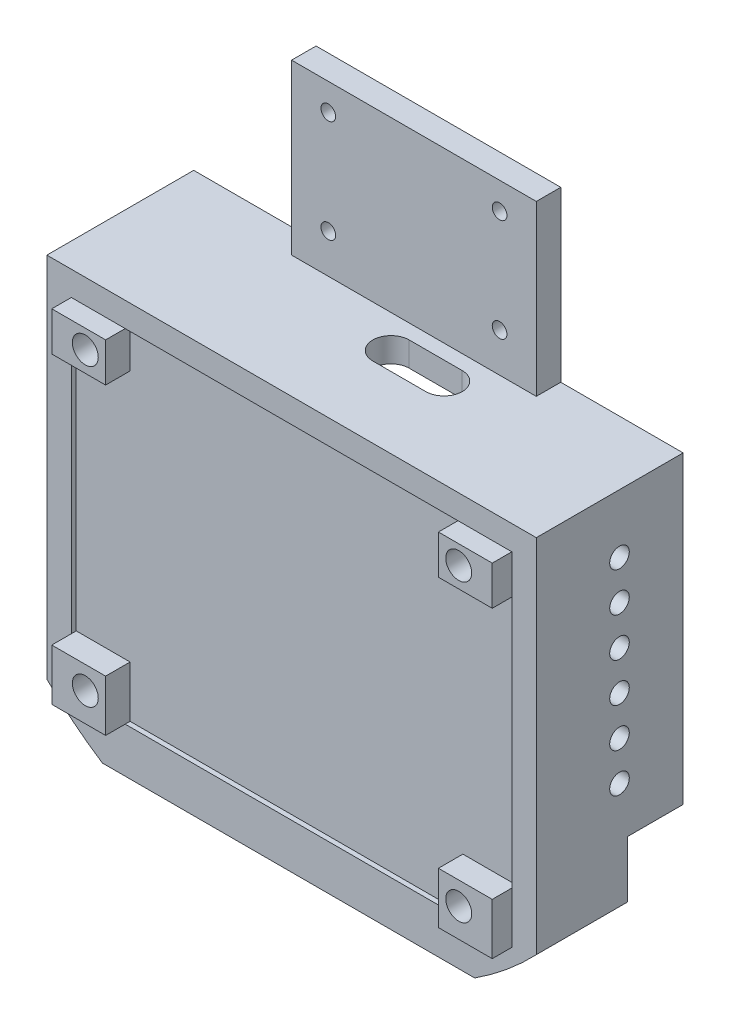
from build123d import *

# Parameters (mm, degrees)
RESSALTO_EXTRUS_O1_DEPTH   = 30
ESBO_O10_W                 = 112.198297798
ESBO_O10_H                 = 48.296192569
CORTE_EXTRUS_O6_DEPTH      = 25
CORTE_EXTRUS_O7_DEPTH      = 90.92898472
CORTE_EXTRUS_O7_DEPTH_BACK = 90.92898472
ESBO_O12_W                 = 36.72404194
ESBO_O12_H                 = 46.699624219
ESBO_O12_W_2               = 36.523308256
ESBO_O12_W_3               = 76.065965206
ESBO_O12_H_2               = 16.622456002
ESBO_O13_W                 = 35
ESBO_O13_H                 = 55
CORTE_EXTRUS_O8_DEPTH      = 20
CORTE_EXTRUS_O9_DEPTH      = 20
ESBO_O15_W                 = 90
ESBO_O15_H                 = 70
CORTE_EXTRUS_O10_DEPTH     = 1
ESBO_O16_W                 = 22.5
ESBO_O16_H                 = 55
CORTE_EXTRUS_O11_DEPTH     = 25
ESBO_O18_W                 = 90
ESBO_O18_H                 = 55
RESSALTO_EXTRUS_O2_DEPTH   = 3
ESBO_O19_W                 = 35
ESBO_O19_H                 = 55
CORTE_EXTRUS_O12_DEPTH     = 3
ESBO_O20_R                 = 2
CORTE_EXTRUS_O13_DEPTH     = 1500
ESBO_O21_W                 = 105.588179738
ESBO_O21_H                 = 28.353928622
CORTE_EXTRUS_O14_DEPTH     = 11.4
CORTE_EXTRUS_O15_DEPTH     = 10
ESBO_O23_R                 = 1.5
CORTE_EXTRUS_O16_DEPTH     = 6
ESBO_O29_W                 = 7
ESBO_O29_H                 = 30
CORTE_EXTRUS_O18_DEPTH     = 1.2
ESBO_O31_W                 = 2.3
ESBO_O31_H                 = 4
CORTE_EXTRUS_O19_DEPTH     = 4
ESBO_O33_W                 = 1
ESBO_O33_H                 = 6
CORTE_EXTRUS_O20_DEPTH     = 4
ESBO_O34_R                 = 2.5
CORTE_EXTRUS_O21_DEPTH     = 6
ESBO_O35_W                 = 11
ESBO_O35_H                 = 8
ESBO_O35_H_2               = 10.5
RESSALTO_EXTRUS_O3_DEPTH   = 5
ESBO_O36_R                 = 2.65
CORTE_EXTRUS_O22_DEPTH     = 4.7
ESBO_O38_W                 = 36
ESBO_O38_H                 = 57
CORTE_EXTRUS_O23_DEPTH     = 1.2
FILETE4_R                  = 1
FILETE5_R                  = 1
FILETE6_R                  = 1
ESBO_O40_R                 = 4.036676011
CORTE_EXTRUS_O25_DEPTH     = 1
FILETE9_R                  = 4


with BuildPart() as part:
    # Esboço1 → Ressalto-extrusão1 (new body)
    with BuildSketch(Plane.XY):
        with BuildLine():
            Line((-49.381601242, -49.613077498), (-49.381601242, 49.613077498))
            ThreePointArc((-49.381601242, 49.613077498), (0.883684189, 69.994421937), (50.618398758, 48.350570908))
            Line((50.618398758, 48.350570908), (50.618398758, -48.350570908))
            ThreePointArc((50.618398758, -48.350570908), (0.883684189, -69.994421937), (-49.381601242, -49.613077498))
        make_face()
    extrude(amount=RESSALTO_EXTRUS_O1_DEPTH)

    # Esboço10 → Corte-extrusão6 (cut)
    with BuildSketch(Plane.XY.offset(30)):
        with Locations((0, 49.593404353)):
            Rectangle(ESBO_O10_W, ESBO_O10_H)
    extrude(amount=-CORTE_EXTRUS_O6_DEPTH, mode=Mode.SUBTRACT)

    # Esboço12 → Corte-extrusão7 (cut, two sides: drawn at the far end of the back side and taken through both)
    with BuildSketch(Plane.XY.offset(5).offset(-CORTE_EXTRUS_O7_DEPTH_BACK)):
        with Locations((-42.743622212, 48.795120178)):
            Rectangle(ESBO_O12_W, ESBO_O12_H)
        with Locations((43.880052886, 48.795120178)):
            Rectangle(ESBO_O12_W_2, ESBO_O12_H)
        with Locations((0, -67.077648977)):
            Rectangle(ESBO_O12_W_3, ESBO_O12_H_2)
    extrude(amount=CORTE_EXTRUS_O7_DEPTH + CORTE_EXTRUS_O7_DEPTH_BACK, mode=Mode.SUBTRACT)

    # Esboço13 → Corte-extrusão8 (cut)
    with BuildSketch(Plane(origin=(0, 0, 0), x_dir=(-1, 0, 0), z_dir=(0, 0, -1))):
        with Locations((-0.618398758, -7.054691932)):
            Rectangle(ESBO_O13_W, ESBO_O13_H)
    extrude(amount=-CORTE_EXTRUS_O8_DEPTH, mode=Mode.SUBTRACT)

    # Esboço14 → Corte-extrusão9 (cut)
    with BuildSketch(Plane(origin=(0, 25.445308068, 0), x_dir=(1, 0, 0), z_dir=(0, 1, 0))):
        with BuildLine():
            Line((2.653109582, -7.998476533), (13.483040952, -7.998476533))
            ThreePointArc((13.483040952, -7.998476533), (17.204697231, -11.720132813), (13.483040952, -15.441789092))
            Line((13.483040952, -15.441789092), (2.653109582, -15.441789092))
            ThreePointArc((2.653109582, -15.441789092), (-1.068546697, -11.720132813), (2.653109582, -7.998476533))
        make_face()
    extrude(amount=-CORTE_EXTRUS_O9_DEPTH, mode=Mode.SUBTRACT)

    # Esboço15 → Corte-extrusão10 (cut)
    with BuildSketch(Plane.XY.offset(30)):
        with Locations((0.618398758, -14.554691932)):
            Rectangle(ESBO_O15_W, ESBO_O15_H)
    extrude(amount=-CORTE_EXTRUS_O10_DEPTH, mode=Mode.SUBTRACT)

    # Esboço16 → Corte-extrusão11 (cut)
    with BuildSketch(Plane(origin=(0, 0, 0), x_dir=(-1, 0, 0), z_dir=(0, 0, -1))):
        with Locations((-34.368398758, -7.054691932)):
            Rectangle(ESBO_O16_W, ESBO_O16_H)
        with Locations((33.131601242, -7.054691932)):
            Rectangle(ESBO_O16_W, ESBO_O16_H)
    extrude(amount=-CORTE_EXTRUS_O11_DEPTH, mode=Mode.SUBTRACT)

    # Esboço18 → Ressalto-extrusão2 (add)
    with BuildSketch(Plane(origin=(0, 0, 0), x_dir=(-1, 0, 0), z_dir=(0, 0, -1))):
        with Locations((-0.618398758, -7.054691932)):
            Rectangle(ESBO_O18_W, ESBO_O18_H)
    extrude(amount=-RESSALTO_EXTRUS_O2_DEPTH)

    # Esboço19 → Corte-extrusão12 (cut)
    with BuildSketch(Plane(origin=(0, 0, 0), x_dir=(-1, 0, 0), z_dir=(0, 0, -1))):
        with Locations((-0.618398758, -7.054691932)):
            Rectangle(ESBO_O19_W, ESBO_O19_H)
    extrude(amount=-CORTE_EXTRUS_O12_DEPTH, mode=Mode.SUBTRACT)

    # Esboço20 → Corte-extrusão13 (cut)
    with BuildSketch(Plane(origin=(50.618398758, 0, 0), x_dir=(0, 0, -1), z_dir=(1, 0, 0))):
        with Locations((-13, 5.445308068)):
            Circle(ESBO_O20_R)
        with Locations((-13, -2.554691932)):
            Circle(ESBO_O20_R)
        with Locations((-13, 13.445308068)):
            Circle(ESBO_O20_R)
        with Locations((-13, -10.554691932)):
            Circle(ESBO_O20_R)
        with Locations((-13, -18.554691932)):
            Circle(ESBO_O20_R)
        with Locations((-13, -26.554691932)):
            Circle(ESBO_O20_R)
    extrude(amount=-CORTE_EXTRUS_O13_DEPTH, mode=Mode.SUBTRACT)

    # Esboço21 → Corte-extrusão14 (cut)
    with BuildSketch(Plane(origin=(0, 0, 0), x_dir=(-1, 0, 0), z_dir=(0, 0, -1))):
        with Locations((2.175691111, -50.943385287)):
            Rectangle(ESBO_O21_W, ESBO_O21_H)
    extrude(amount=-CORTE_EXTRUS_O14_DEPTH, mode=Mode.SUBTRACT)

    # Esboço22 → Corte-extrusão15 (cut)
    with BuildSketch(Plane.XY.offset(5)):
        Polygon((-29.980530995, 70.945308068), (31.249974599, 70.942177058), (31.249974599, 59.945308068), (-29.980530995, 59.945308068), align=None)
    extrude(amount=-CORTE_EXTRUS_O15_DEPTH, mode=Mode.SUBTRACT)

    # Esboço23 → Corte-extrusão16 (cut)
    with BuildSketch(Plane.XY.offset(5)):
        with Locations((-16.881601242, 54.445308068)):
            Circle(ESBO_O23_R)
        with Locations((-16.881601242, 33.445308068)):
            Circle(ESBO_O23_R)
        with Locations((18.118398758, 33.445308068)):
            Circle(ESBO_O23_R)
        with Locations((18.118398758, 54.445308068)):
            Circle(ESBO_O23_R)
    extrude(amount=-CORTE_EXTRUS_O16_DEPTH, mode=Mode.SUBTRACT)

    # Esboço29 → Corte-extrusão18 (cut)
    with BuildSketch(Plane(origin=(0, 0, 0), x_dir=(-1, 0, 0), z_dir=(0, 0, -1))):
        with Locations((-21.618398758, -7.054691932)):
            Rectangle(ESBO_O29_W, ESBO_O29_H)
    extrude(amount=-CORTE_EXTRUS_O18_DEPTH, mode=Mode.SUBTRACT)

    # Esboço31 → Corte-extrusão19 (cut)
    with BuildSketch(Plane.ZY.offset(-18.118398758)):
        with Locations((2.35, 14.688444073)):
            Rectangle(ESBO_O31_W, ESBO_O31_H)
        with Locations((2.35, -28.797827937)):
            Rectangle(ESBO_O31_W, ESBO_O31_H)
    extrude(amount=-CORTE_EXTRUS_O19_DEPTH, mode=Mode.SUBTRACT)

    # Esboço33 → Corte-extrusão20 (cut)
    with BuildSketch(Plane(origin=(-16.881601242, 0, 0), x_dir=(0, 0, -1), z_dir=(1, 0, 0))):
        with Locations((-2, -6.723435912)):
            Rectangle(ESBO_O33_W, ESBO_O33_H)
    extrude(amount=-CORTE_EXTRUS_O20_DEPTH, mode=Mode.SUBTRACT)

    # Esboço34 → Corte-extrusão21 (cut)
    with BuildSketch(Plane(origin=(0, 0, 11.4), x_dir=(-1, 0, 0), z_dir=(0, 0, -1))):
        with Locations((20, -49.366420976)):
            Circle(ESBO_O34_R)
        with Locations((-20, -49.366420976)):
            Circle(ESBO_O34_R)
    extrude(amount=-CORTE_EXTRUS_O21_DEPTH, mode=Mode.SUBTRACT)

    # Esboço35 → Ressalto-extrusão3 (add)
    with BuildSketch(Plane.XY.offset(29)):
        with Locations((-38.881601242, 16.445308068)):
            Rectangle(ESBO_O35_W, ESBO_O35_H)
        with Locations((40.118398758, 16.445308068)):
            Rectangle(ESBO_O35_W, ESBO_O35_H)
        with Locations((40.118398758, -44.304691932)):
            Rectangle(ESBO_O35_W, ESBO_O35_H_2)
        with Locations((-38.881601242, -44.304691932)):
            Rectangle(ESBO_O35_W, ESBO_O35_H_2)
    extrude(amount=RESSALTO_EXTRUS_O3_DEPTH)

    # Esboço36 → Corte-extrusão22 (cut)
    with BuildSketch(Plane.XY.offset(34)):
        with Locations((-37.531601242, 16.595308068)):
            Circle(ESBO_O36_R)
        with Locations((38.768398758, 16.595308068)):
            Circle(ESBO_O36_R)
        with Locations((38.768398758, -43.704691932)):
            Circle(ESBO_O36_R)
        with Locations((-37.531601242, -43.704691932)):
            Circle(ESBO_O36_R)
    extrude(amount=-CORTE_EXTRUS_O22_DEPTH, mode=Mode.SUBTRACT)

    # Esboço38 → Corte-extrusão23 (cut)
    with BuildSketch(Plane(origin=(0, 0, 0), x_dir=(-1, 0, 0), z_dir=(0, 0, -1))):
        with Locations((-0.118398758, -7.054691932)):
            Rectangle(ESBO_O38_W, ESBO_O38_H)
    extrude(amount=-CORTE_EXTRUS_O23_DEPTH, mode=Mode.SUBTRACT)

    # Filete4
    filete4_edges = [part.edges().sort_by_distance(p)[0] for p in [
        (-17.881601242, 21.445308068, 0.6),
    ]]
    fillet(filete4_edges, radius=FILETE4_R)

    # Filete5
    filete5_edges = [part.edges().sort_by_distance(p)[0] for p in [
        (18.118398758, -35.554691932, 0.6),
        (-17.881601242, -35.554691932, 0.6),
        (18.118398758, 21.445308068, 0.6),
    ]]
    fillet(filete5_edges, radius=FILETE5_R)

    # Filete6
    filete6_edges = [part.edges().sort_by_distance(p)[0] for p in [
        (25.118398758, -22.054691932, 0.6),
        (25.118398758, 7.945308068, 0.6),
    ]]
    fillet(filete6_edges, radius=FILETE6_R)

    # Esboço40 → Corte-extrusão25 (cut)
    with BuildSketch(Plane(origin=(0, 0, 0), x_dir=(-1, 0, 0), z_dir=(0, 0, -1))):
        with Locations((16.881601242, -6.723435912)):
            Circle(ESBO_O40_R)
    extrude(amount=-CORTE_EXTRUS_O25_DEPTH, mode=Mode.SUBTRACT)

    # Filete9
    # the kernel refuses this fillet: 4 mm, written as the material it adds along each edge
    with BuildSketch(Plane(origin=(-16.881601242, -6.723435912, 1), x_dir=(0.9837182515450056, 0.17971756057001487, 0), z_dir=(0.17971756057001487, -0.9837182515450056, 0))) as filete9_piece_1_section:
        with BuildLine():
            CenterArc((1.3909247, -4), FILETE9_R, 48.590377891, 41.409622109)
            Line((1.3909247, 0), (1.3909247, 0.08))
            Line((1.3909247, 0.08), (4.036676011, 0.08))
            Line((4.036676011, 0.08), (4.116676011, 0))
            ThreePointArc((4.116676011, 0), (4.116676011, -0.5), (4.089591037, -0.94))
            Line((4.089591037, -0.94), (4.036676011, -1))
        make_face()
    filete9_piece_1 = revolve(axis=Axis((-16.881601242, -6.723435912, 1), (0, 0, 1)), revolution_arc=339.293382111, mode=Mode.PRIVATE)
    filete9_piece_1 = split(filete9_piece_1, bisect_by=Plane(origin=(-17.881601242, -6.723435912, 1), z_dir=(-1, 0, 0)), keep=Keep.TOP, mode=Mode.PRIVATE)
    add(filete9_piece_1)


solid = part.part
